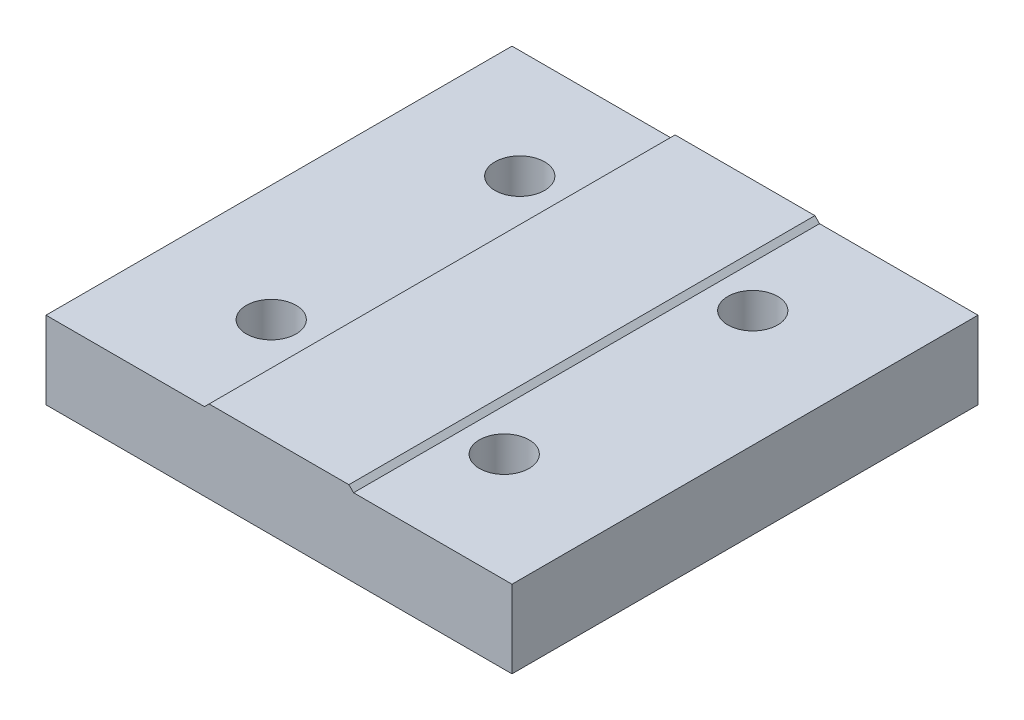
from build123d import *

# Parameters (mm, degrees)
SKETCH_1_W      = 30
SKETCH_1_H      = 30
SKETCH_1_R      = 1.6
EXTRUDE_1_DEPTH = 5
SKETCH_2_W      = 9.6
SKETCH_2_H      = 30
EXTRUDE_2_DEPTH = 0.3
CHAMFER_2_SIZE  = 0.3


with BuildPart() as part:
    # 草图1 → 凸台-拉伸1 (new body)
    with BuildSketch(Plane(origin=(0, 0, 0), x_dir=(1, 0, 0), z_dir=(0, 1, 0))):
        with Locations((15, -15)):
            Rectangle(SKETCH_1_W, SKETCH_1_H)
        with Locations(Location((7.5, -7, 0), (0, 0, 270))):
            Circle(SKETCH_1_R, mode=Mode.SUBTRACT)
        with Locations(Location((22.5, -7, 0), (0, 0, 270))):
            Circle(SKETCH_1_R, mode=Mode.SUBTRACT)
        with Locations(Location((22.5, -23, 0), (0, 0, 270))):
            Circle(SKETCH_1_R, mode=Mode.SUBTRACT)
        with Locations(Location((7.5, -23, 0), (0, 0, 270))):
            Circle(SKETCH_1_R, mode=Mode.SUBTRACT)
    extrude(amount=EXTRUDE_1_DEPTH)

    # 草图2 → 凸台-拉伸2 (add)
    with BuildSketch(Plane(origin=(0, 5, 0), x_dir=(1, 0, 0), z_dir=(0, 1, 0))):
        with Locations((15, -15)):
            Rectangle(SKETCH_2_W, SKETCH_2_H)
    extrude(amount=EXTRUDE_2_DEPTH)

    # 倒角2
    chamfer_2_edges = [part.edges().sort_by_distance(p)[0] for p in [
        (19.8, 5.3, 15),
        (10.2, 5.3, 15),
    ]]
    chamfer(chamfer_2_edges, length=CHAMFER_2_SIZE - 0.0001)  # a hair under: the kernel refuses the full size


solid = part.part
